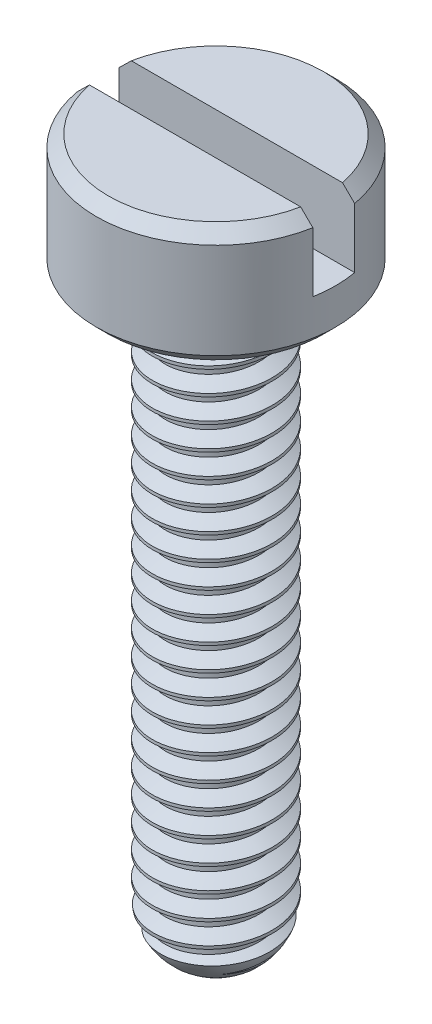
from build123d import *

# Parameters (mm, degrees)
SKETCH1_R               = 2
BOSS_EXTRUDE1_DEPTH     = 2
SKETCH2_R               = 1
BOSS_EXTRUDE2_DEPTH     = 10
CHAMFER1_SIZE           = 0.2
FILLET1_R               = 1
THREAD1_PITCH           = 0.4
CUT_EXTRUDE1_DEPTH      = 11.392304845
CUT_EXTRUDE1_DEPTH_BACK = 11.392304845
SKETCH8_W               = 0.7
SKETCH8_H               = 1.2


with BuildPart() as part:
    # Sketch1 → Boss-Extrude1 (new body)
    with BuildSketch(Plane(origin=(0, 0, 0), x_dir=(1, 0, 0), z_dir=(0, 1, 0))):
        with Locations(Location((0, 0, 0), (0, 0, 270))):
            Circle(SKETCH1_R)
    extrude(amount=BOSS_EXTRUDE1_DEPTH)

    # Sketch2 → Boss-Extrude2 (add)
    with BuildSketch(Plane.XZ):
        with Locations(Location((0, 0, 0), (0, 0, 270))):
            Circle(SKETCH2_R)
    extrude(amount=BOSS_EXTRUDE2_DEPTH)

    # Chamfer1
    chamfer1_edges = [part.edges().sort_by_distance(p)[0] for p in [
        (0, 0, -2),
        (0, 2, -2),
    ]]
    chamfer(chamfer1_edges, length=CHAMFER1_SIZE)

    # Fillet1
    fillet1_edges = [part.edges().sort_by_distance(p)[0] for p in [
        (0, -10, 1),
    ]]
    fillet(fillet1_edges, radius=FILLET1_R)

    # Thread1: the profile of Thread Profile2 profile screwed along a right-hand helix of 27.5 turns, 6 arcs to a turn; built about Z, then put on its axis
    thread1_z = Axis((0, 0, 0), (0, 0, 1))
    thread1_corners = [(1.0003, 0, -0.000173205), (1.0003, 0, 0.350173204), (0.78349365, 0, 0.224999999), (0.78349365, 0, 0.124999999)]
    with BuildLine(mode=Mode.PRIVATE) as thread1_profile:
        Line(thread1_corners[0], thread1_corners[1])
        Line(thread1_corners[1], thread1_corners[2])
        Line(thread1_corners[2], thread1_corners[3])
        Line(thread1_corners[3], thread1_corners[0])
    thread1_cap = Face(thread1_profile.wire())
    thread1_turn_angles = [0, 30, 60, 90, 120, 150, 180, 210, 240, 270, 300, 330, 360]
    thread1_turn_weights = [1, 0.8660254037844387, 1, 0.8660254037844387, 1, 0.8660254037844387, 1, 0.8660254037844387, 1, 0.8660254037844387, 1, 0.8660254037844387, 1]
    thread1_turn_rails = [Edge.make_bspline([Vector(p[0], p[1], 0).rotate(thread1_z, thread1_turn_angles[k]) / thread1_turn_weights[k] + Vector(0, 0, p[2] + THREAD1_PITCH * thread1_turn_angles[k] / 360) for k in range(13)], [0, 0, 0, 1, 1, 2, 2, 3, 3, 4, 4, 5, 5, 6, 6, 6], 2, thread1_turn_weights) for p in thread1_corners]
    thread1_turn_sides = [Face.make_surface_from_curves(thread1_turn_rails[p[0]], thread1_turn_rails[p[1]]) for p in [(0, 1), (1, 2), (2, 3), (3, 0)]]
    thread1_last_angles = [9720, 9750, 9780, 9810, 9840, 9870, 9900]
    thread1_last_weights = [1, 0.8660254037844387, 1, 0.8660254037844387, 1, 0.8660254037844387, 1]
    thread1_last_rails = [Edge.make_bspline([Vector(p[0], p[1], 0).rotate(thread1_z, thread1_last_angles[k]) / thread1_last_weights[k] + Vector(0, 0, p[2] + THREAD1_PITCH * thread1_last_angles[k] / 360) for k in range(7)], [0, 0, 0, 1, 1, 2, 2, 3, 3, 3], 2, thread1_last_weights) for p in thread1_corners]
    thread1_last_sides = [Face.make_surface_from_curves(thread1_last_rails[p[0]], thread1_last_rails[p[1]]) for p in [(0, 1), (1, 2), (2, 3), (3, 0)]]
    thread1 = Plane(origin=(0, -11, 0), x_dir=(1, 0, 0), z_dir=(0, 1, 0)) * Solid(Shell([*[p.moved(Location((0, 0, THREAD1_PITCH * i))) for i in range(27) for p in thread1_turn_sides], *thread1_last_sides, thread1_cap, thread1_cap.rotate(thread1_z, 9900).moved(Location((0, 0, THREAD1_PITCH * 9900 / 360)))]))
    add(thread1, mode=Mode.SUBTRACT)

    # Sketch8 → Cut-Extrude1 (cut, two sides: drawn at the far end of the back side and taken through both)
    with BuildSketch(Plane(origin=(0, 0, 0), x_dir=(0, 0, -1), z_dir=(1, 0, 0)).offset(-CUT_EXTRUDE1_DEPTH_BACK)):
        with Locations((0, 1.4)):
            Rectangle(SKETCH8_W, SKETCH8_H)
    extrude(amount=CUT_EXTRUDE1_DEPTH + CUT_EXTRUDE1_DEPTH_BACK, mode=Mode.SUBTRACT)


solid = part.part
